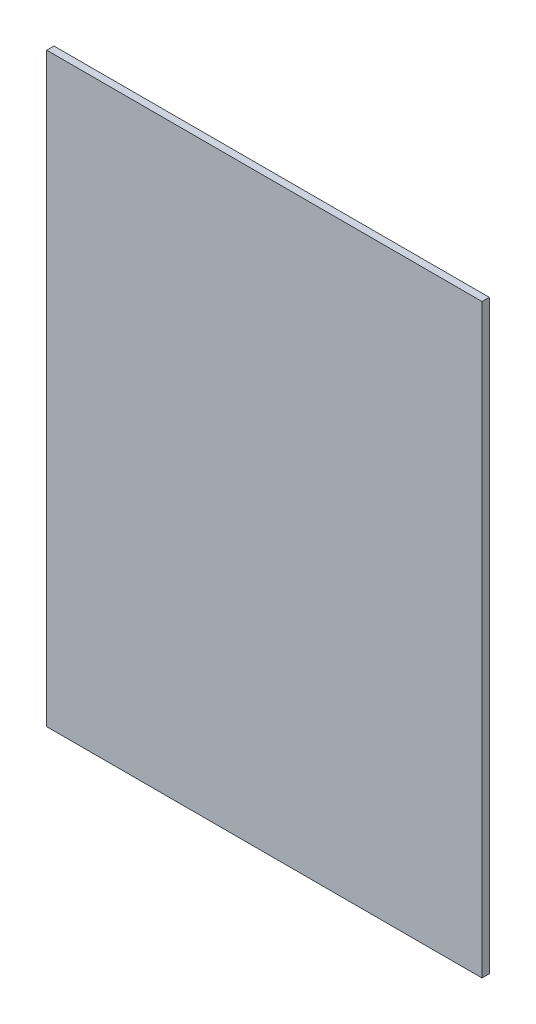
from build123d import *

# Parameters (mm, degrees)
SKETCH_1_W             = 120
SKETCH_1_H             = 161.5
SM_BASE_FLANGE_1_DEPTH = 2


# Sheet-metal steps are written as plain solids
with BuildPart() as part:
    # Sketch 1 → 基体-法兰1 (new body)
    with BuildSketch(Plane.XY):
        Rectangle(SKETCH_1_W, SKETCH_1_H)
    extrude(amount=-SM_BASE_FLANGE_1_DEPTH)


solid = part.part
